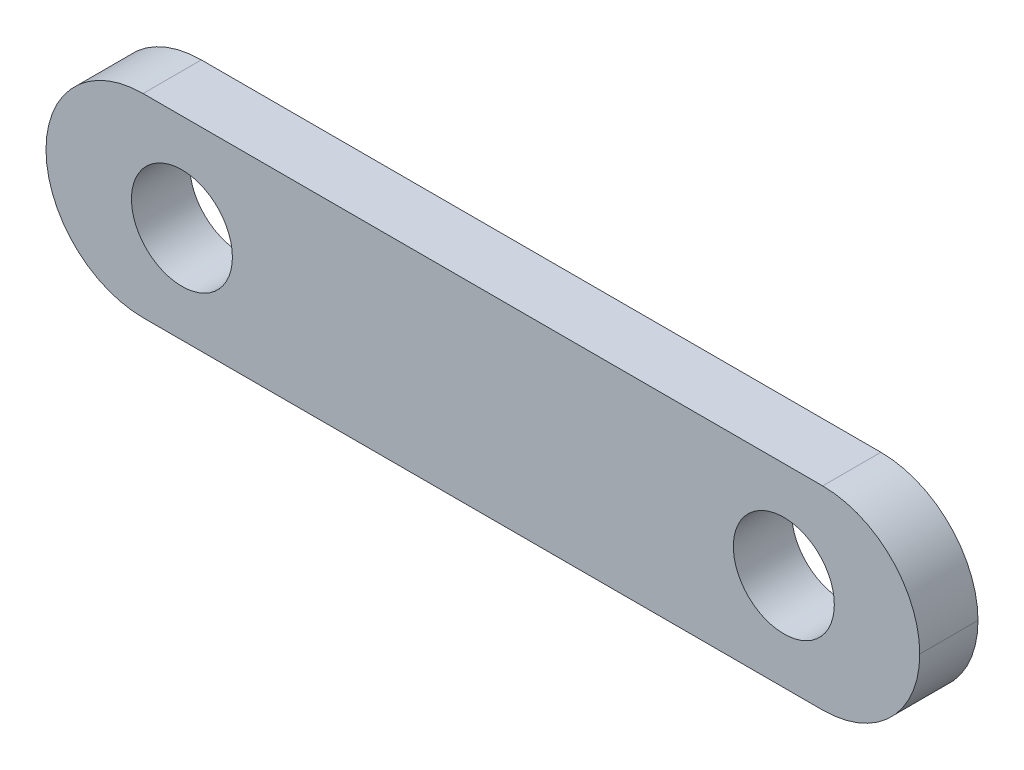
from build123d import *

# Parameters (mm, degrees)
ESQUISSE1_W             = 45
ESQUISSE1_H             = 10
EXTRUSION1_DEPTH        = 3
ESQUISSE2_R             = 2.6
ENL_V_MAT_EXTRU_1_DEPTH = 3
CONG_1_R                = 5


with BuildPart() as part:
    # Esquisse1 → Extrusion1 (new body)
    with BuildSketch(Plane.XY):
        with Locations((-25.203257042, 6.02306338)):
            Rectangle(ESQUISSE1_W, ESQUISSE1_H)
    extrude(amount=EXTRUSION1_DEPTH)

    # Esquisse2 → Enlèv. mat.-Extru.1 (cut)
    with BuildSketch(Plane.XY.offset(3)):
        with Locations((-40.703257042, 6.02306338)):
            Circle(ESQUISSE2_R)
        with Locations((-9.703257042, 6.02306338)):
            Circle(ESQUISSE2_R)
    extrude(amount=-ENL_V_MAT_EXTRU_1_DEPTH, mode=Mode.SUBTRACT)

    # Congé1
    cong_1_edges = [part.edges().sort_by_distance(p)[0] for p in [
        (-47.703257042, 1.02306338, 1.5),
        (-2.703257042, 1.02306338, 1.5),
        (-2.703257042, 11.02306338, 1.5),
        (-47.703257042, 11.02306338, 1.5),
    ]]
    fillet(cong_1_edges, radius=CONG_1_R - 0.0001)  # a hair under: the kernel refuses the full size


solid = part.part
